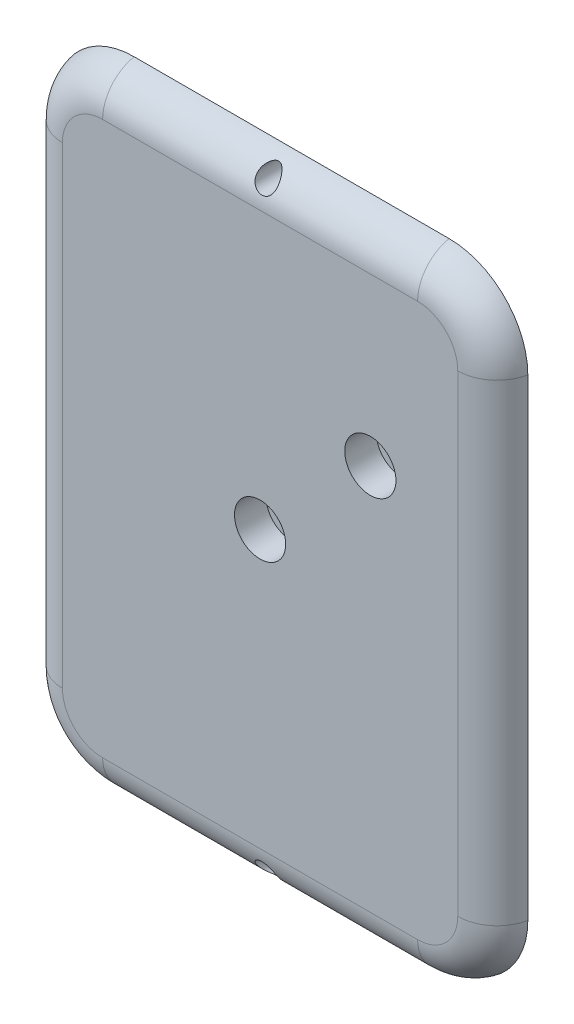
from build123d import *

# Parameters (mm, degrees)
EXTRUDE_1_DEPTH = 3
EXTRUDE_START   = 3
SKETCH_2_R      = 1.35
SKETCH_2_R_2    = 3.25
EXTRUDE_2_DEPTH = 4
FILLET_1_R      = 5


with BuildPart() as part:
    # 草圖1 → 填料-伸長1 (new body)
    with BuildSketch(Plane.XY):
        with BuildLine():
            Line((25.7, -30), (25.7, 30))
            ThreePointArc((25.7, 30), (24.030508653, 34.030508653), (20, 35.7))
            Line((20, 35.7), (-20, 35.7))
            ThreePointArc((-20, 35.7), (-24.030508653, 34.030508653), (-25.7, 30))
            Line((-25.7, 30), (-25.7, -30))
            ThreePointArc((-25.7, -30), (-24.030508653, -34.030508653), (-20, -35.7))
            Line((-20, -35.7), (20, -35.7))
            ThreePointArc((20, -35.7), (24.030508653, -34.030508653), (25.7, -30))
        make_face()
    extrude(amount=EXTRUDE_1_DEPTH)

    # 草圖2 → 填料-伸長2 (add)
    with BuildSketch(Plane.XY.offset(EXTRUDE_START)):
        with BuildLine():
            Line((30, -30), (30, 30))
            ThreePointArc((30, 30), (27.071067812, 37.071067812), (20, 40))
            Line((20, 40), (-20, 40))
            ThreePointArc((-20, 40), (-27.071067812, 37.071067812), (-30, 30))
            Line((-30, 30), (-30, -30))
            ThreePointArc((-30, -30), (-27.071067812, -37.071067812), (-20, -40))
            Line((-20, -40), (20, -40))
            ThreePointArc((20, -40), (27.071067812, -37.071067812), (30, -30))
        make_face()
        with Locations((0, 38)):
            Circle(SKETCH_2_R, mode=Mode.SUBTRACT)
        with Locations((0, -38)):
            Circle(SKETCH_2_R, mode=Mode.SUBTRACT)
        Circle(SKETCH_2_R_2, mode=Mode.SUBTRACT)
        with Locations((14, 14)):
            Circle(SKETCH_2_R_2, mode=Mode.SUBTRACT)
    extrude(amount=EXTRUDE_2_DEPTH)

    # 圓角1
    # the kernel refuses this fillet: 5 mm, written as the material it takes off along each edge
    with BuildSketch(Plane(origin=(20, -30, 7), x_dir=(0, -1, 0), z_dir=(-1, 0, 0))) as fillet_1_piece_1:
        with BuildLine():
            CenterArc((5.101020514, -5), FILLET_1_R, 11.536959033, 78.463040967)
            Line((5.101020514, 0), (5.101020514, 0.1))
            Line((5.101020514, 0.1), (10, 0.1))
            Line((10, 0.1), (10.1, 0))
            ThreePointArc((10.1, 0), (10.1, -2), (10.09797959, -3.98))
            Line((10.09797959, -3.98), (10, -4))
        make_face()
    revolve(axis=Axis((20, -30, 7), (0, 0, 1)), revolution_arc=90, mode=Mode.SUBTRACT)
    with BuildSketch(Plane(origin=(30, -30, 7), x_dir=(-1.5640821970914211e-12, 0, -1.0), z_dir=(0, 1, 0)), Plane(origin=(-30, 30, 7), x_dir=(1.5640821970914211e-12, 0, -1.0), z_dir=(0, -1, 0))) as fillet_1_piece_2:
        with BuildLine():
            CenterArc((5, 4.898979486), FILLET_1_R, 180, 78.463040967)
            Line((0, 4.898979486), (-0.1, 4.898979486))
            Line((-0.1, 4.898979486), (-0.1, 0))
            Line((-0.1, 0), (0, -0.1))
            ThreePointArc((0, -0.1), (2, -0.1), (3.98, -0.09797959))
            Line((3.98, -0.09797959), (4, 0))
        make_face()
    extrude(amount=60, mode=Mode.SUBTRACT)
    with BuildSketch(Plane(origin=(20, 30, 7), x_dir=(1, 0, 0), z_dir=(0, -1, 0))) as fillet_1_piece_3:
        with BuildLine():
            CenterArc((5.101020514, -5), FILLET_1_R, 11.536959033, 78.463040967)
            Line((5.101020514, 0), (5.101020514, 0.1))
            Line((5.101020514, 0.1), (10, 0.1))
            Line((10, 0.1), (10.1, 0))
            ThreePointArc((10.1, 0), (10.1, -2), (10.09797959, -3.98))
            Line((10.09797959, -3.98), (10, -4))
        make_face()
    revolve(axis=Axis((20, 30, 7), (0, 0, 1)), revolution_arc=90, mode=Mode.SUBTRACT)
    with BuildSketch(Plane(origin=(20, 40, 7), x_dir=(0, -1.5667467323505197e-12, -1.0), z_dir=(-1, 0, 0)), Plane(origin=(-20, -40, 7), x_dir=(0, 1.5667467323505197e-12, -1.0), z_dir=(1, 0, 0))) as fillet_1_piece_4:
        with BuildLine():
            CenterArc((5, 4.898979486), FILLET_1_R, 180, 78.463040967)
            Line((0, 4.898979486), (-0.1, 4.898979486))
            Line((-0.1, 4.898979486), (-0.1, 0))
            Line((-0.1, 0), (0, -0.1))
            ThreePointArc((0, -0.1), (2, -0.1), (3.98, -0.09797959))
            Line((3.98, -0.09797959), (4, 0))
        make_face()
    extrude(amount=40, mode=Mode.SUBTRACT)
    with BuildSketch(Plane(origin=(-20, 30, 7), x_dir=(0, 1, 0), z_dir=(1, 0, 0))) as fillet_1_piece_5:
        with BuildLine():
            CenterArc((5.101020514, -5), FILLET_1_R, 11.536959033, 78.463040967)
            Line((5.101020514, 0), (5.101020514, 0.1))
            Line((5.101020514, 0.1), (10, 0.1))
            Line((10, 0.1), (10.1, 0))
            ThreePointArc((10.1, 0), (10.1, -2), (10.09797959, -3.98))
            Line((10.09797959, -3.98), (10, -4))
        make_face()
    revolve(axis=Axis((-20, 30, 7), (0, 0, 1)), revolution_arc=90, mode=Mode.SUBTRACT)
    with BuildSketch(Plane(origin=(-20, -30, 7), x_dir=(-1, 0, 0), z_dir=(0, 1, 0))) as fillet_1_piece_6:
        with BuildLine():
            CenterArc((5.101020514, -5), FILLET_1_R, 11.536959033, 78.463040967)
            Line((5.101020514, 0), (5.101020514, 0.1))
            Line((5.101020514, 0.1), (10, 0.1))
            Line((10, 0.1), (10.1, 0))
            ThreePointArc((10.1, 0), (10.1, -2), (10.09797959, -3.98))
            Line((10.09797959, -3.98), (10, -4))
        make_face()
    revolve(axis=Axis((-20, -30, 7), (0, 0, 1)), revolution_arc=90, mode=Mode.SUBTRACT)


solid = part.part
